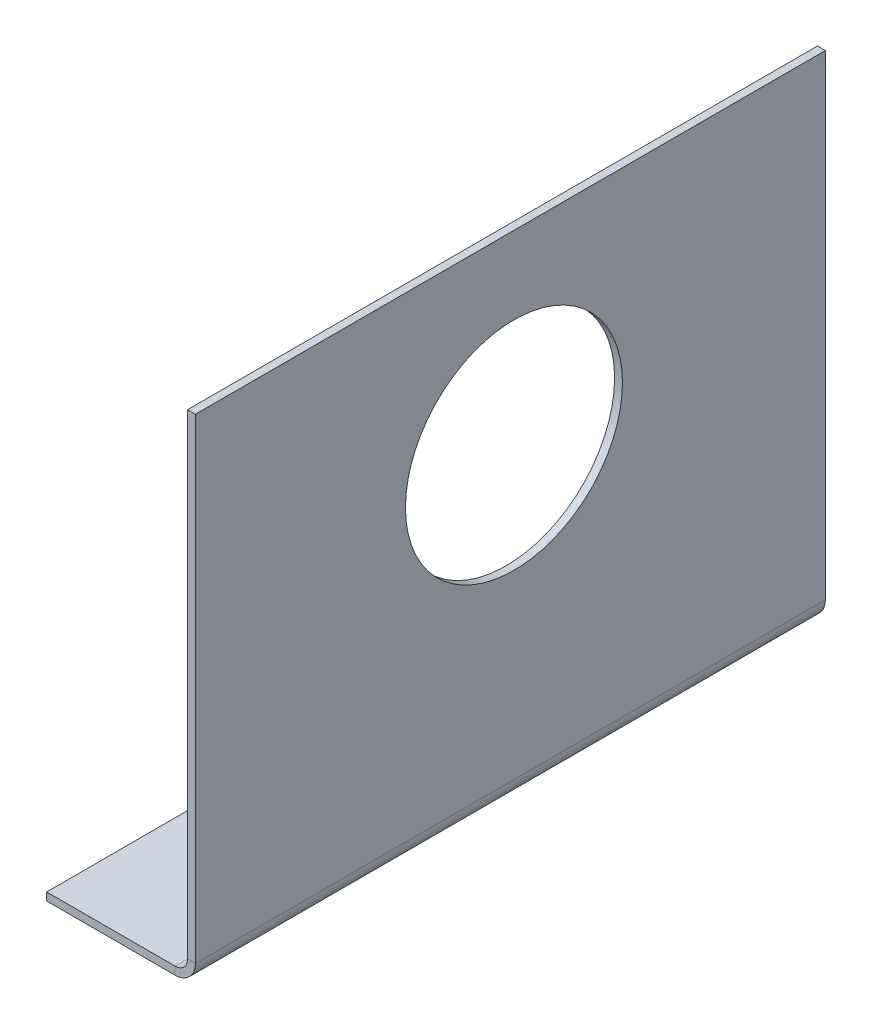
from build123d import *

# Parameters (mm, degrees)
SKETCH1_W                    = 50.8
SKETCH1_H                    = 40
BASE_FLANGE1_DEPTH           = 0.635
EDGE_FLANGE1_STRIP_W         = 4.54
EDGE_FLANGE1_STRIP_H         = 0.635
EDGE_FLANGE1_STRIP_CUT_DEPTH = 50.8
EDGE_FLANGE1_DEPTH           = 50.8
SKETCH9_R                    = 8.75
CUT_EXTRUDE1_DEPTH           = 35.48419928
SKETCH10_R                   = 2.65
CUT_EXTRUDE2_DEPTH           = 49.360761212


# Sheet-metal steps are written as plain solids
with BuildPart() as part:
    # Sketch1 → Base-Flange1 (new body)
    with BuildSketch(Plane(origin=(0, 0, 0), x_dir=(0, 0, -1), z_dir=(1, 0, 0))):
        Rectangle(SKETCH1_W, SKETCH1_H)
    extrude(amount=-BASE_FLANGE1_DEPTH)

    # Edge-Flange1 strip (across the edge) → Edge-Flange1 strip cut (cut)
    with BuildSketch(Plane(origin=(-0.635, -20, -25.4), x_dir=(0, 1, 0), z_dir=(0, 0, 1))):
        with Locations((-0.635, -0.3175)):
            Rectangle(EDGE_FLANGE1_STRIP_W, EDGE_FLANGE1_STRIP_H)
    extrude(amount=EDGE_FLANGE1_STRIP_CUT_DEPTH, mode=Mode.SUBTRACT)

    # Edge-Flange1 section (across the edge) → Edge-Flange1 (add)
    with BuildSketch(Plane(origin=(-0.635, -20, -25.4), x_dir=(0, 1, 0), z_dir=(0, 0, 1))):
        with BuildLine():
            Line((0, 1), (0, 11.365))
            Line((0, 11.365), (0.635, 11.365))
            Line((0.635, 11.365), (0.635, 1))
            ThreePointArc((0.635, 1), (0.927893219, 0.292893219), (1.635, 0))
            Line((1.635, 0), (1.635, -0.635))
            ThreePointArc((1.635, -0.635), (0.478880413, -0.156119587), (0, 1))
        make_face()
    extrude(amount=EDGE_FLANGE1_DEPTH)

    # Sketch9 → Cut-Extrude1 (cut, through all)
    with BuildSketch(Plane(origin=(0, 0, 0), x_dir=(0, 0, -1), z_dir=(1, 0, 0))):
        with Locations((0.287892683, 5)):
            Circle(SKETCH9_R)
    extrude(amount=-CUT_EXTRUDE1_DEPTH, mode=Mode.SUBTRACT)

    # Sketch10 → Cut-Extrude2 (cut, through all)
    with BuildSketch(Plane(origin=(0, -19.365, 0), x_dir=(1, 0, 0), z_dir=(0, 1, 0))):
        with Locations(Location((-6.8175, 12, 0), (0, 0, 180))):
            Circle(SKETCH10_R)
        with BuildLine():
            Line((-4.1675, -9.5), (-4.1675, -14.5))
            ThreePointArc((-4.1675, -14.5), (-6.8175, -17.15), (-9.4675, -14.5))
            Line((-9.4675, -14.5), (-9.4675, -9.5))
            ThreePointArc((-9.4675, -9.5), (-6.8175, -6.85), (-4.1675, -9.5))
        make_face()
    extrude(amount=-CUT_EXTRUDE2_DEPTH, mode=Mode.SUBTRACT)


solid = part.part
